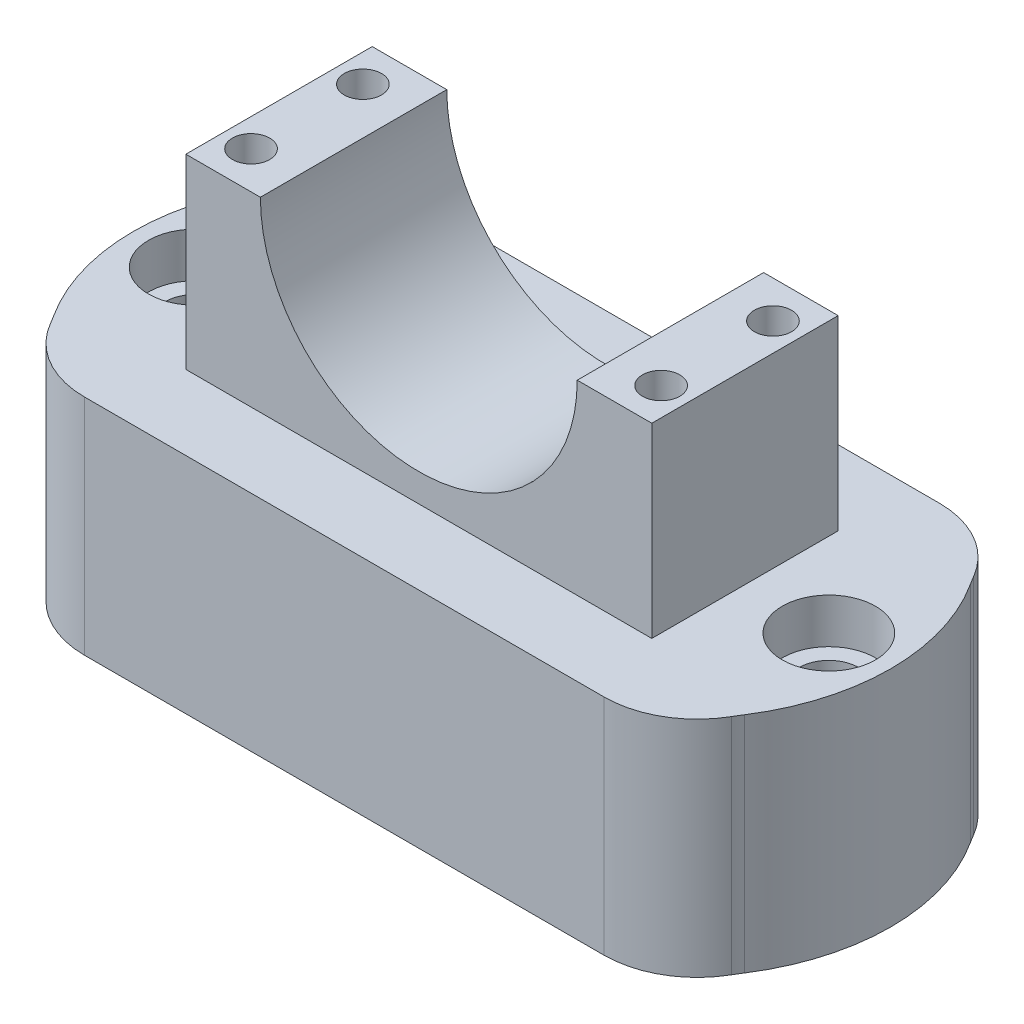
from build123d import *

# Parameters (mm, degrees)
CROQUIS2_W                                           = 47.2
CROQUIS2_H                                           = 18
SALIENTE_EXTRUIR1_DEPTH                              = 12
SALIENTE_EXTRUIR2_DEPTH                              = 5
SALIENTE_EXTRUIR2_DEPTH_BACK                         = 5
REFRENTADO_PARA_TORNILLO_CON_CABEZA_TRON_D           = 3.2
REFRENTADO_PARA_TORNILLO_CON_CABEZA_TRON_DEPTH       = 30
REFRENTADO_PARA_TORNILLO_CON_CABEZA_TRON_CBORE_D     = 5
REFRENTADO_PARA_TORNILLO_CON_CABEZA_TRON_CBORE_DEPTH = 2.4
REFRENTADO_PARA_TORNILLO_CON_CABEZA_TRON_TIP         = 0.96137699
TALADRO_DE_MARGEN_PARA_M21_D                         = 2
TALADRO_DE_MARGEN_PARA_M21_DEPTH                     = 15
TALADRO_DE_MARGEN_PARA_M21_TIP                       = 0.600860619
CROQUIS14_R                                          = 10
CORTAR_EXTRUIR1_DEPTH                                = 16
REDONDEO1_R                                          = 6
CORTAR_EXTRUIR2_DEPTH                                = 16
REDONDEO2_R                                          = 5
REDONDEO3_R                                          = 5


with BuildPart() as part:
    # Croquis2 → Saliente-Extruir1 (new body)
    with BuildSketch(Plane(origin=(0, 0, 0), x_dir=(1, 0, 0), z_dir=(0, 1, 0))):
        with Locations((17, 0)):
            Rectangle(CROQUIS2_W, CROQUIS2_H)
    extrude(amount=SALIENTE_EXTRUIR1_DEPTH)

    # Croquis4 → Saliente-Extruir2 (add, two sides: drawn at the far end of the back side and taken through both)
    with BuildSketch(Plane(origin=(0, 0, 0), x_dir=(-1, 0, 0), z_dir=(0, 0, -1)).offset(-SALIENTE_EXTRUIR2_DEPTH_BACK)):
        with BuildLine():
            Line((-25.5, 22), (-29.5, 22))
            Line((-29.5, 22), (-29.5, 12))
            Line((-29.5, 12), (-4.5, 12))
            Line((-4.5, 12), (-4.5, 22))
            Line((-4.5, 22), (-8.5, 22))
            ThreePointArc((-8.5, 22), (-17, 13.5), (-25.5, 22))
        make_face()
    extrude(amount=SALIENTE_EXTRUIR2_DEPTH + SALIENTE_EXTRUIR2_DEPTH_BACK)

    # Refrentado para tornillo con cabeza troncocónica de M31
    with Locations(Plane.ZX.offset(12)):
        with Locations((0, 0), (0, 34)):
            CounterBoreHole(REFRENTADO_PARA_TORNILLO_CON_CABEZA_TRON_D / 2, REFRENTADO_PARA_TORNILLO_CON_CABEZA_TRON_CBORE_D / 2, REFRENTADO_PARA_TORNILLO_CON_CABEZA_TRON_CBORE_DEPTH, depth=REFRENTADO_PARA_TORNILLO_CON_CABEZA_TRON_DEPTH)
            with Locations((0, 0, -(REFRENTADO_PARA_TORNILLO_CON_CABEZA_TRON_DEPTH + REFRENTADO_PARA_TORNILLO_CON_CABEZA_TRON_TIP / 2))):  # 118° drill point
                Cone(0, REFRENTADO_PARA_TORNILLO_CON_CABEZA_TRON_D / 2, REFRENTADO_PARA_TORNILLO_CON_CABEZA_TRON_TIP, mode=Mode.SUBTRACT)

    # Taladro de margen para M21
    with Locations(Plane(origin=(6, 22, -3), x_dir=(0, 0, 1), z_dir=(0, 1, 0))):
        with Locations((0, 0), (6, 0), (0, 22), (6, 22)):
            Hole(TALADRO_DE_MARGEN_PARA_M21_D / 2, depth=TALADRO_DE_MARGEN_PARA_M21_DEPTH)
            with Locations((0, 0, -(TALADRO_DE_MARGEN_PARA_M21_DEPTH + TALADRO_DE_MARGEN_PARA_M21_TIP / 2))):  # 118° drill point
                Cone(0, TALADRO_DE_MARGEN_PARA_M21_D / 2, TALADRO_DE_MARGEN_PARA_M21_TIP, mode=Mode.SUBTRACT)

    # Croquis14 → Cortar-Extruir1 (cut)
    with BuildSketch(Plane(origin=(0, 12, 0), x_dir=(1, 0, 0), z_dir=(0, 1, 0))):
        with Locations((43.936945617, 11.477309168)):
            Circle(CROQUIS14_R)
        with Locations((-9.936945617, 11.477309168)):
            Circle(CROQUIS14_R)
        with Locations((43.936945617, -11.477309168)):
            Circle(CROQUIS14_R)
        with Locations((-9.936945617, -11.477309168)):
            Circle(CROQUIS14_R)
    extrude(amount=-CORTAR_EXTRUIR1_DEPTH, mode=Mode.SUBTRACT)

    # Redondeo1
    # the kernel refuses this fillet: 6 mm, written as the material it takes off along each edge
    with BuildSketch(Plane(origin=(-6.6, -8.915795606, -2.050496666), x_dir=(0, 0, 1), z_dir=(0, 1, 0))) as redondeo1_piece_1:
        with BuildLine():
            CenterArc((3.566318242, 6), REDONDEO1_R, 215.701262203, 54.298737797)
            ThreePointArc((-1.306105787, 2.498645393), (-0.564551793, 1.295584483), (0, 0))
            Line((0, 0), (3.566318242, 0))
        make_face()
    extrude(amount=29.831591212, mode=Mode.SUBTRACT)
    with BuildSketch(Plane(origin=(-6.6, -8.915795606, 2.050496666), x_dir=(0, 0, -1), z_dir=(0, 1, 0)), Plane(origin=(40.6, -8.915795606, -2.050496666), x_dir=(0, 0, 1), z_dir=(0, 1, 0))) as redondeo1_piece_2:
        with BuildLine():
            CenterArc((3.566318242, -6), REDONDEO1_R, 90, 54.298737797)
            ThreePointArc((-1.306105787, -2.498645393), (-0.564551793, -1.295584483), (0, 0))
            Line((0, 0), (3.566318242, 0))
        make_face()
    extrude(amount=29.831591212, mode=Mode.SUBTRACT)
    with BuildSketch(Plane(origin=(40.6, -8.915795606, 2.050496666), x_dir=(-0.886226070867775, 0, 0.46325301004339436), z_dir=(0, 1, 0))) as redondeo1_piece_3:
        with BuildLine():
            CenterArc((3.665248765, -5.940082264), REDONDEO1_R, 98.104043871, 54.298737797)
            Line((-1.652107661, -3.160564203), (0, 0))
            ThreePointArc((0, 0), (1.409711063, -0.099862894), (2.819422127, 0))
        make_face()
    extrude(amount=29.831591212, mode=Mode.SUBTRACT)

    # Croquis15 → Cortar-Extruir2 (cut)
    with BuildSketch(Plane(origin=(0, 12, 0), x_dir=(1, 0, 0), z_dir=(0, 1, 0))):
        with BuildLine():
            ThreePointArc((-1.535379674, 6.05387025), (-3.319618886, 0), (-1.535379674, -6.05387025))
            ThreePointArc((-1.535379674, -6.05387025), (-2.691742174, -4.584775013), (-4.101354607, -3.356602453))
            ThreePointArc((-4.101354607, -3.356602453), (-5.546762714, -1.879695859), (-6.405366909, 0))
            ThreePointArc((-6.405366909, 0), (-5.546762714, 1.879695859), (-4.101354607, 3.356602453))
            ThreePointArc((-4.101354607, 3.356602453), (-2.691742174, 4.584775013), (-1.535379674, 6.05387025))
        make_face()
        with BuildLine():
            ThreePointArc((38.101354607, 3.356602453), (36.691742174, 4.584775013), (35.535379674, 6.05387025))
            ThreePointArc((35.535379674, 6.05387025), (37.319618886, 0), (35.535379674, -6.05387025))
            ThreePointArc((35.535379674, -6.05387025), (36.691742174, -4.584775013), (38.101354607, -3.356602453))
            ThreePointArc((38.101354607, -3.356602453), (39.546762714, -1.879695859), (40.405366909, 0))
            ThreePointArc((40.405366909, 0), (39.546762714, 1.879695859), (38.101354607, 3.356602453))
        make_face()
    extrude(amount=-CORTAR_EXTRUIR2_DEPTH, mode=Mode.SUBTRACT)

    # Redondeo2
    redondeo2_edges = [part.edges().sort_by_distance(p)[0] for p in [
        (34.248656848, 6, -9),
        (-0.248656848, 6, -9),
    ]]
    fillet(redondeo2_edges, radius=REDONDEO2_R)

    # Redondeo3
    redondeo3_edges = [part.edges().sort_by_distance(p)[0] for p in [
        (34.248656848, 6, 9),
        (-0.248656848, 6, 9),
    ]]
    fillet(redondeo3_edges, radius=REDONDEO3_R)


solid = part.part
